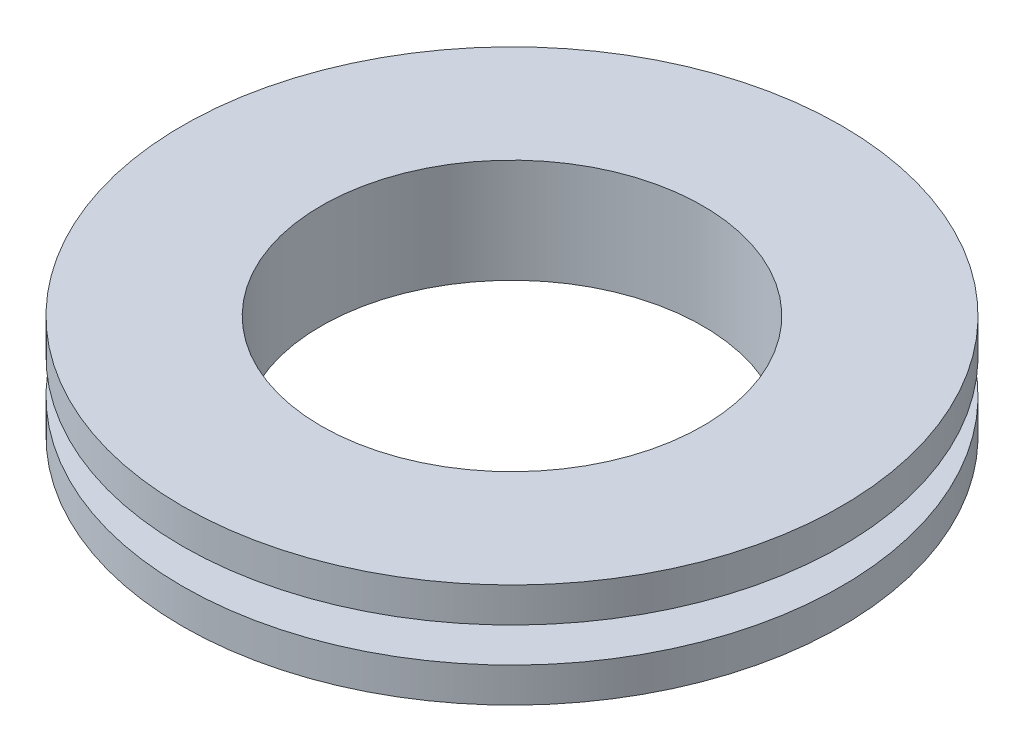
from build123d import *

# Parameters (mm, degrees)
SKETCH1_R           = 7.5
SKETCH1_R_2         = 5.5
BOSS_EXTRUDE1_DEPTH = 3
BOSS_EXTRUDE2_START = -1
SKETCH2_R           = 9.5
SKETCH2_R_2         = 7.5
BOSS_EXTRUDE2_DEPTH = 1
SKETCH3_R           = 9.5
SKETCH3_R_2         = 7.5
BOSS_EXTRUDE3_DEPTH = 1
FILLET1_R           = 0.5


with BuildPart() as part:
    # Sketch1 → Boss-Extrude1 (new body)
    with BuildSketch(Plane(origin=(0, 0, 0), x_dir=(1, 0, 0), z_dir=(0, 1, 0))):
        with Locations(Location((0, 0, 0), (0, 0, 270))):
            Circle(SKETCH1_R)
        with Locations(Location((0, 0, 0), (0, 0, 270))):
            Circle(SKETCH1_R_2, mode=Mode.SUBTRACT)
    extrude(amount=BOSS_EXTRUDE1_DEPTH)

    # Sketch2 → Boss-Extrude2 (add)
    with BuildSketch(Plane(origin=(0, 3, 0), x_dir=(1, 0, 0), z_dir=(0, 1, 0)).offset(BOSS_EXTRUDE2_START)):
        with Locations(Location((0, 0, 0), (0, 0, 270))):
            Circle(SKETCH2_R)
        with Locations(Location((0, 0, 0), (0, 0, 270))):
            Circle(SKETCH2_R_2, mode=Mode.SUBTRACT)
    extrude(amount=BOSS_EXTRUDE2_DEPTH)

    # Sketch3 → Boss-Extrude3 (add)
    with BuildSketch(Plane.XZ):
        with Locations(Location((0, 0, 0), (0, 0, 90))):
            Circle(SKETCH3_R)
        with Locations(Location((0, 0, 0), (0, 0, 270))):
            Circle(SKETCH3_R_2, mode=Mode.SUBTRACT)
    extrude(amount=-BOSS_EXTRUDE3_DEPTH)

    # Fillet1
    fillet1_edges = [part.edges().sort_by_distance(p)[0] for p in [
        (0, 2, -7.5),
        (0, 1, -7.5),
    ]]
    fillet(fillet1_edges, radius=FILLET1_R - 0.0001)  # a hair under: the kernel refuses the full size


solid = part.part
